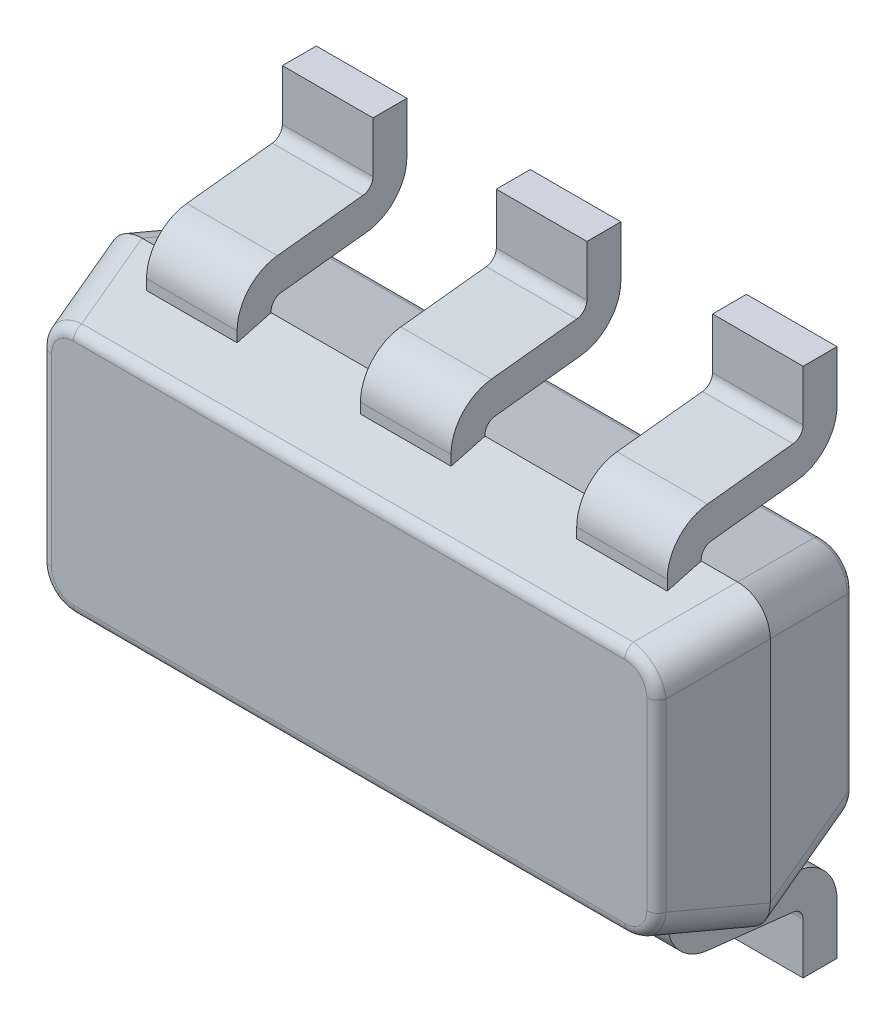
from build123d import *

# Parameters (mm, degrees)
EXTRUDE_START             = 0.6
SKETCH_1_W                = 2.92
SKETCH_1_H                = 1.3
EXTRUDE_1_DEPTH           = 0.4
EXTRUDE_1_TAPER           = 15
EXTRUDE_1_OTHER_WAY_DEPTH = 0.5
EXTRUDE_1_OTHER_WAY_TAPER = 15
EXTRUDE_START_2           = 0.955
EXTRUDE_2_DEPTH           = 0.2
PATTERN_LINEAR_1_COUNT    = 2
PATTERN_LINEAR_1_PITCH    = 1.9
EXTRUDE_3_DEPTH           = 0.2
EXTRUDE_3_DEPTH_BACK      = 0.2
FILLET_1_R                = 0.15
FILLET_2_R                = 0.05


with BuildPart() as part:
    # Эскиз1 → Вытянуть1 (new body)
    with BuildSketch(Plane.XY.offset(EXTRUDE_START)):
        Rectangle(SKETCH_1_W, SKETCH_1_H)
    extrude(amount=EXTRUDE_1_DEPTH, taper=EXTRUDE_1_TAPER)

    # Эскиз1 → Вытянуть1 other way (add)
    with BuildSketch(Plane.XY.offset(EXTRUDE_START)):
        Rectangle(SKETCH_1_W, SKETCH_1_H)
    extrude(amount=-EXTRUDE_1_OTHER_WAY_DEPTH, taper=EXTRUDE_1_OTHER_WAY_TAPER)

    # Эскиз2 → Вытянуть2 (add, symmetric)
    with BuildSketch(Plane(origin=(0, 0, 0), x_dir=(0, 0, -1), z_dir=(1, 0, 0)).offset(EXTRUDE_START_2)):
        with BuildLine():
            Line((0, -1.17), (0, -0.94529724))
            ThreePointArc((0, -0.94529724), (-0.051033425, -0.811847027), (-0.178089594, -0.746501028))
            Line((-0.178089594, -0.746501028), (-0.555477601, -0.704907054))
            ThreePointArc((-0.555477601, -0.704907054), (-0.587241644, -0.688570555), (-0.6, -0.655208001))
            Line((-0.6, -0.655208001), (-0.6, -0.6))
            Line((-0.6, -0.6), (-0.75, -0.6))
            Line((-0.75, -0.6), (-0.75, -0.655208001))
            ThreePointArc((-0.75, -0.655208001), (-0.698966575, -0.788658214), (-0.571910406, -0.854004214))
            Line((-0.571910406, -0.854004214), (-0.194522399, -0.895598187))
            ThreePointArc((-0.194522399, -0.895598187), (-0.162758356, -0.911934687), (-0.15, -0.94529724))
            Line((-0.15, -0.94529724), (-0.15, -1.17))
            Line((-0.15, -1.17), (0, -1.17))
        make_face()
        with BuildLine():
            Line((-0.194522399, 0.895598187), (-0.571910406, 0.854004214))
            ThreePointArc((-0.571910406, 0.854004214), (-0.698966575, 0.788658214), (-0.75, 0.655208001))
            Line((-0.75, 0.655208001), (-0.75, 0.6))
            Line((-0.75, 0.6), (-0.6, 0.6))
            Line((-0.6, 0.6), (-0.6, 0.655208001))
            ThreePointArc((-0.6, 0.655208001), (-0.587241644, 0.688570555), (-0.555477601, 0.704907054))
            Line((-0.555477601, 0.704907054), (-0.178089594, 0.746501028))
            ThreePointArc((-0.178089594, 0.746501028), (-0.051033425, 0.811847027), (0, 0.94529724))
            Line((0, 0.94529724), (0, 1.17))
            Line((0, 1.17), (-0.15, 1.17))
            Line((-0.15, 1.17), (-0.15, 0.94529724))
            ThreePointArc((-0.15, 0.94529724), (-0.162758356, 0.911934687), (-0.194522399, 0.895598187))
        make_face()
    extrude_2 = extrude(amount=EXTRUDE_2_DEPTH, both=True)

    # Линейный массив1: Вытянуть2 ×2
    with Locations(*[(-i * PATTERN_LINEAR_1_PITCH, 0, 0) for i in range(1, PATTERN_LINEAR_1_COUNT)]):
        add(extrude_2)

    # Эскиз2<3> → Вытянуть3 (add, two sides: drawn at the far end of the back side and taken through both)
    with BuildSketch(Plane(origin=(0, 0, 0), x_dir=(0, 0, -1), z_dir=(1, 0, 0)).offset(-EXTRUDE_3_DEPTH_BACK)):
        with BuildLine():
            Line((-0.194522399, 0.895598187), (-0.571910406, 0.854004214))
            ThreePointArc((-0.571910406, 0.854004214), (-0.698966575, 0.788658214), (-0.75, 0.655208001))
            Line((-0.75, 0.655208001), (-0.75, 0.6))
            Line((-0.75, 0.6), (-0.6, 0.6))
            Line((-0.6, 0.6), (-0.6, 0.655208001))
            ThreePointArc((-0.6, 0.655208001), (-0.587241644, 0.688570555), (-0.555477601, 0.704907054))
            Line((-0.555477601, 0.704907054), (-0.178089594, 0.746501028))
            ThreePointArc((-0.178089594, 0.746501028), (-0.051033425, 0.811847027), (0, 0.94529724))
            Line((0, 0.94529724), (0, 1.17))
            Line((0, 1.17), (-0.15, 1.17))
            Line((-0.15, 1.17), (-0.15, 0.94529724))
            ThreePointArc((-0.15, 0.94529724), (-0.162758356, 0.911934687), (-0.194522399, 0.895598187))
        make_face()
    extrude(amount=EXTRUDE_3_DEPTH + EXTRUDE_3_DEPTH_BACK)

    # Скругление1
    fillet_1_edges = [part.edges().sort_by_distance(p)[0] for p in [
        (1.406410162, -0.596410162, 0.8),
        (1.406410162, 0.596410162, 0.8),
        (-1.406410162, 0.596410162, 0.8),
        (-1.406410162, -0.596410162, 0.8),
        (1.393012702, -0.583012702, 0.35),
        (-1.393012702, -0.583012702, 0.35),
        (-1.393012702, 0.583012702, 0.35),
        (1.393012702, 0.583012702, 0.35),
    ]]
    fillet(fillet_1_edges, radius=FILLET_1_R)

    # Скругление2
    fillet_2_edges = [part.edges().sort_by_distance(p)[0] for p in [
        (-1.326025404, 0, 0.1),
        (0, -0.516025404, 0.1),
        (1.326025404, 0, 0.1),
        (0, 0.516025404, 0.1),
        (1.284159844, 0.474159844, 0.1),
        (1.284159844, -0.474159844, 0.1),
        (-1.284159844, 0.474159844, 0.1),
        (-1.284159844, -0.474159844, 0.1),
        (0, 0.542820323, 1),
        (1.352820323, 0, 1),
        (-1.352820323, 0, 1),
        (0, -0.542820323, 1),
        (-1.310954763, -0.500954763, 1),
        (-1.310954763, 0.500954763, 1),
        (1.310954763, -0.500954763, 1),
        (1.310954763, 0.500954763, 1),
    ]]
    fillet(fillet_2_edges, radius=FILLET_2_R)


solid = part.part
